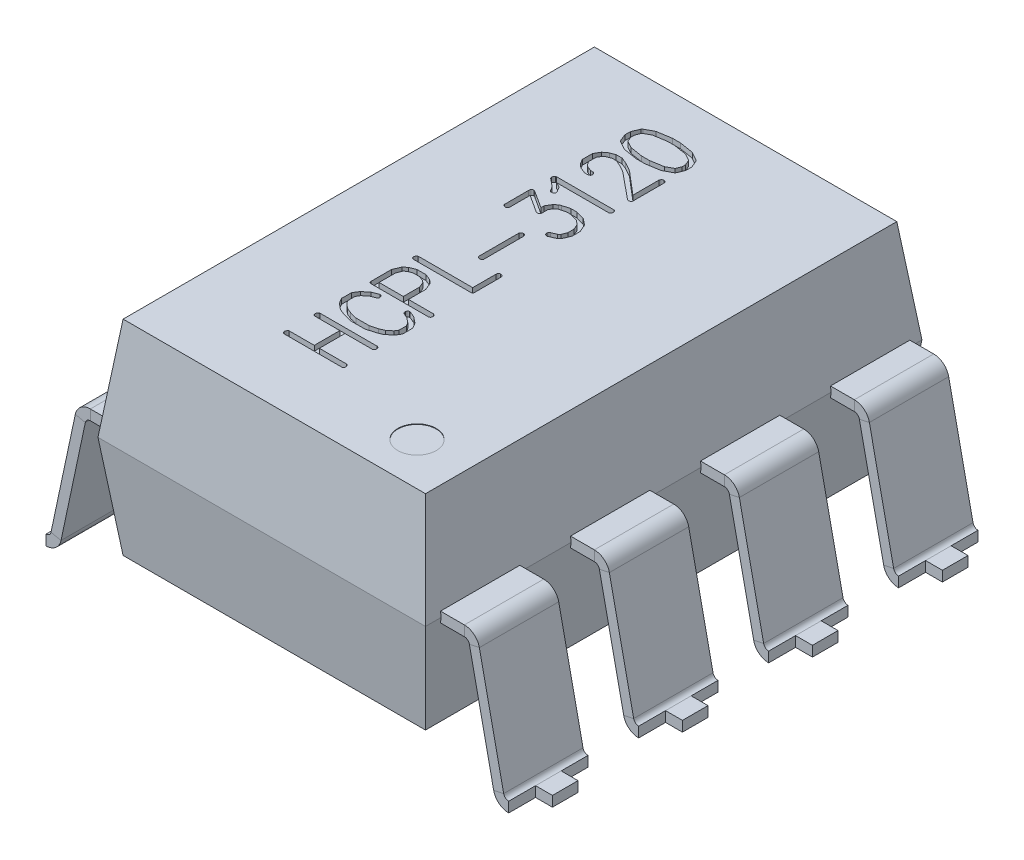
from build123d import *

# Parameters (mm, degrees)
SKETCH1_W                     = 6.4
SKETCH1_H                     = 9.7
BOSS_EXTRUDE1_DEPTH           = 2
BOSS_EXTRUDE1_TAPER           = 7
BOSS_EXTRUDE1_OTHER_WAY_DEPTH = 2
BOSS_EXTRUDE1_OTHER_WAY_TAPER = 7
SKETCH4_W                     = 1.55
SKETCH4_H                     = 0.2
SKETCH10_W                    = 0.329696675
SKETCH10_H                    = 0.525
CUT_EXTRUDE3_DEPTH            = 5
LPATTERN4_START               = -4.625
LPATTERN4_DEPTH               = 1.55
LPATTERN4_START_2             = -2.085
LPATTERN4_2_DEPTH             = 1.55
LPATTERN4_START_3             = 0.455
LPATTERN4_3_DEPTH             = 1.55
LPATTERN4_START_4             = -4.1
LPATTERN4_4_OUTLINE_W         = 0.329696675
LPATTERN4_4_OUTLINE_H         = 0.2
LPATTERN4_4_DEPTH             = 0.5
LPATTERN4_START_5             = -1.56
LPATTERN4_5_OUTLINE_W         = 0.329696675
LPATTERN4_5_OUTLINE_H         = 0.2
LPATTERN4_5_DEPTH             = 0.5
LPATTERN4_START_6             = 0.98
LPATTERN4_6_OUTLINE_W         = 0.329696675
LPATTERN4_6_OUTLINE_H         = 0.2
LPATTERN4_6_DEPTH             = 0.5
CUT_EXTRUDE2_DEPTH            = 0.1
SKETCH5_R                     = 0.375
CUT_EXTRUDE4_DEPTH            = 0.01


# Read off the part's stored shape, not the designer's step: LPattern4
with BuildPart() as part:
    # Sketch1 → Boss-Extrude1 (new body)
    with BuildSketch(Plane(origin=(0, 0, 0), x_dir=(1, 0, 0), z_dir=(0, 1, 0))):
        Rectangle(SKETCH1_W, SKETCH1_H)
    extrude(amount=BOSS_EXTRUDE1_DEPTH, taper=BOSS_EXTRUDE1_TAPER)

    # Sketch1 → Boss-Extrude1 other way (add)
    with BuildSketch(Plane(origin=(0, 0, 0), x_dir=(1, 0, 0), z_dir=(0, 1, 0))):
        Rectangle(SKETCH1_W, SKETCH1_H)
    extrude(amount=-BOSS_EXTRUDE1_OTHER_WAY_DEPTH, taper=BOSS_EXTRUDE1_OTHER_WAY_TAPER)

    # Sweep2: sweep along a path in Sketch3
    with BuildLine(Plane.XY) as sweep2_path:
        Line((2.2403605, 0), (3.65437048, 0))
        ThreePointArc((3.65437048, 0), (3.780234558, -0.044570808), (3.85, -0.158417662))
        Line((3.85, -0.158417662), (4.324673805, -2.391582338))
        ThreePointArc((4.324673805, -2.391582338), (4.394439247, -2.505429192), (4.520303325, -2.55))
        Line((4.520303325, -2.55), (4.85, -2.55))
    # Sketch4 → Sweep2 (sweep)
    with BuildSketch(Plane(origin=(3.2, 0, 0), x_dir=(0, 0, -1), z_dir=(1, 0, 0))):
        with Locations((-3.77, 0)):
            Rectangle(SKETCH4_W, SKETCH4_H)
    sweep2 = sweep(path=sweep2_path.line)

    # Sketch10 → Cut-Extrude3 (cut)
    with BuildSketch(Plane(origin=(0, -2.45, 0), x_dir=(1, 0, 0), z_dir=(0, 1, 0))):
        with Locations((4.685151663, -3.2575)):
            Rectangle(SKETCH10_W, SKETCH10_H)
        with Locations((4.685151663, -4.2825)):
            Rectangle(SKETCH10_W, SKETCH10_H)
    cut_extrude3 = extrude(amount=-CUT_EXTRUDE3_DEPTH, mode=Mode.SUBTRACT)

    # LPattern4 outline → LPattern4 (add)
    with BuildSketch(Plane.XY.offset(LPATTERN4_START)):
        with BuildLine():
            Line((3.65437048, 0.1), (3.187721544, 0.1))
            Line((3.187721544, 0.1), (3.2, 0))
            Line((3.2, 0), (3.187721544, -0.1))
            Line((3.187721544, -0.1), (3.65437048, -0.1))
            ThreePointArc((3.65437048, -0.1), (3.717302519, -0.122285404), (3.75218524, -0.179208831))
            Line((3.75218524, -0.179208831), (4.226859045, -2.412373507))
            ThreePointArc((4.226859045, -2.412373507), (4.331507208, -2.583143788), (4.520303325, -2.65))
            Line((4.520303325, -2.65), (4.520303325, -2.45))
            ThreePointArc((4.520303325, -2.45), (4.457371286, -2.427714596), (4.422488565, -2.370791169))
            Line((4.422488565, -2.370791169), (3.94781476, -0.137626493))
            ThreePointArc((3.94781476, -0.137626493), (3.843166597, 0.033143788), (3.65437048, 0.1))
        make_face()
    lpattern4 = extrude(amount=LPATTERN4_DEPTH)

    # LPattern4 2 outline → LPattern4 2 (add)
    with BuildSketch(Plane.XY.offset(LPATTERN4_START_2)):
        with BuildLine():
            Line((3.65437048, 0.1), (3.187721544, 0.1))
            Line((3.187721544, 0.1), (3.2, 0))
            Line((3.2, 0), (3.187721544, -0.1))
            Line((3.187721544, -0.1), (3.65437048, -0.1))
            ThreePointArc((3.65437048, -0.1), (3.717302519, -0.122285404), (3.75218524, -0.179208831))
            Line((3.75218524, -0.179208831), (4.226859045, -2.412373507))
            ThreePointArc((4.226859045, -2.412373507), (4.331507208, -2.583143788), (4.520303325, -2.65))
            Line((4.520303325, -2.65), (4.520303325, -2.45))
            ThreePointArc((4.520303325, -2.45), (4.457371286, -2.427714596), (4.422488565, -2.370791169))
            Line((4.422488565, -2.370791169), (3.94781476, -0.137626493))
            ThreePointArc((3.94781476, -0.137626493), (3.843166597, 0.033143788), (3.65437048, 0.1))
        make_face()
    lpattern4_2 = extrude(amount=LPATTERN4_2_DEPTH)

    # LPattern4 3 outline → LPattern4 3 (add)
    with BuildSketch(Plane.XY.offset(LPATTERN4_START_3)):
        with BuildLine():
            Line((3.65437048, 0.1), (3.187721544, 0.1))
            Line((3.187721544, 0.1), (3.2, 0))
            Line((3.2, 0), (3.187721544, -0.1))
            Line((3.187721544, -0.1), (3.65437048, -0.1))
            ThreePointArc((3.65437048, -0.1), (3.717302519, -0.122285404), (3.75218524, -0.179208831))
            Line((3.75218524, -0.179208831), (4.226859045, -2.412373507))
            ThreePointArc((4.226859045, -2.412373507), (4.331507208, -2.583143788), (4.520303325, -2.65))
            Line((4.520303325, -2.65), (4.520303325, -2.45))
            ThreePointArc((4.520303325, -2.45), (4.457371286, -2.427714596), (4.422488565, -2.370791169))
            Line((4.422488565, -2.370791169), (3.94781476, -0.137626493))
            ThreePointArc((3.94781476, -0.137626493), (3.843166597, 0.033143788), (3.65437048, 0.1))
        make_face()
    lpattern4_3 = extrude(amount=LPATTERN4_3_DEPTH)

    # LPattern4 4 outline → LPattern4 4 (add)
    with BuildSketch(Plane.XY.offset(LPATTERN4_START_4)):
        with Locations((4.685151663, -2.55)):
            Rectangle(LPATTERN4_4_OUTLINE_W, LPATTERN4_4_OUTLINE_H)
    lpattern4_4 = extrude(amount=LPATTERN4_4_DEPTH)

    # LPattern4 5 outline → LPattern4 5 (add)
    with BuildSketch(Plane.XY.offset(LPATTERN4_START_5)):
        with Locations((4.685151663, -2.55)):
            Rectangle(LPATTERN4_5_OUTLINE_W, LPATTERN4_5_OUTLINE_H)
    lpattern4_5 = extrude(amount=LPATTERN4_5_DEPTH)

    # LPattern4 6 outline → LPattern4 6 (add)
    with BuildSketch(Plane.XY.offset(LPATTERN4_START_6)):
        with Locations((4.685151663, -2.55)):
            Rectangle(LPATTERN4_6_OUTLINE_W, LPATTERN4_6_OUTLINE_H)
    lpattern4_6 = extrude(amount=LPATTERN4_6_DEPTH)

    # Mirror2: Sweep2, Cut-Extrude3, LPattern4, LPattern4 2, LPattern4 3, LPattern4 4, LPattern4 5, LPattern4 6 across plane
    add(sweep2.mirror(Plane(origin=(0, 0, 0), x_dir=(0, 0, 1), z_dir=(1, 0, 0))))
    add(cut_extrude3.mirror(Plane(origin=(0, 0, 0), x_dir=(0, 0, 1), z_dir=(1, 0, 0))), mode=Mode.SUBTRACT)
    add(lpattern4.mirror(Plane(origin=(0, 0, 0), x_dir=(0, 0, 1), z_dir=(1, 0, 0))))
    add(lpattern4_2.mirror(Plane(origin=(0, 0, 0), x_dir=(0, 0, 1), z_dir=(1, 0, 0))))
    add(lpattern4_3.mirror(Plane(origin=(0, 0, 0), x_dir=(0, 0, 1), z_dir=(1, 0, 0))))
    add(lpattern4_4.mirror(Plane(origin=(0, 0, 0), x_dir=(0, 0, 1), z_dir=(1, 0, 0))))
    add(lpattern4_5.mirror(Plane(origin=(0, 0, 0), x_dir=(0, 0, 1), z_dir=(1, 0, 0))))
    add(lpattern4_6.mirror(Plane(origin=(0, 0, 0), x_dir=(0, 0, 1), z_dir=(1, 0, 0))))

    # Sketch8 → Cut-Extrude2 (cut)
    # profile 1 of 9: a face of its own
    with BuildSketch(Plane(origin=(0, 2, 0), x_dir=(1, 0, 0), z_dir=(0, 1, 0))):
        with BuildLine():
            add(Edge.make_bspline(
                [(-1.169419643, 3.524821429), (-1.167620934, 3.528908118), (-1.163740142, 3.537725324), (-1.1578385, 3.551915849), (-1.151034501, 3.567867523), (-1.14372345, 3.585569203), (-1.135985944, 3.605153948), (-1.127082649, 3.626293824), (-1.118176155, 3.649517547), (-1.111639799, 3.665459517), (-1.108258929, 3.673705357)],
                knots=[0, 0, 0, 0, 0.665721593, 1.436322902, 2.291410995, 3.251459109, 4.291796754, 5.431062308, 6.671240151, 8, 8, 8, 8], degree=3))
            Line((-1.108258929, 3.673705357), (-1.090848214, 3.688214286))
            Line((-1.090848214, 3.688214286), (-0.931696429, 3.774151786))
            Line((-0.931696429, 3.774151786), (-0.914955357, 3.7790625))
            Line((-0.914955357, 3.7790625), (-0.65, 3.822142857))
            Line((-0.65, 3.822142857), (-0.485044643, 3.822142857))
            Line((-0.485044643, 3.822142857), (-0.213616071, 3.7775))
            Line((-0.213616071, 3.7775), (-0.208705357, 3.773928571))
            Line((-0.208705357, 3.773928571), (-0.038839286, 3.678839286))
            Line((-0.038839286, 3.678839286), (-0.031473214, 3.670133929))
            add(Edge.make_bspline(
                [(-0.031473214, 3.670133929), (-0.029657628, 3.664760515), (-0.025798258, 3.653338317), (-0.018664975, 3.635434712), (-0.010689902, 3.615396775), (-0.001941105, 3.59406877), (0.007352249, 3.573273859), (0.015109624, 3.554043583), (0.022431149, 3.537815211), (0.026653801, 3.527804899), (0.028571429, 3.523258929)],
                knots=[0, 0, 0, 0, 0.857513826, 1.822806147, 2.913397241, 4.118986067, 5.308242042, 6.357181207, 7.253948727, 8, 8, 8, 8], degree=3))
            Line((0.028571429, 3.523258929), (0.028571429, 3.411205357))
            add(Edge.make_bspline(
                [(0.028571429, 3.411205357), (0.025122374, 3.40218313), (0.017503778, 3.382253988), (0.003809982, 3.349919533), (-0.011818338, 3.311776482), (-0.02346924, 3.284625052), (-0.0296875, 3.270133929)],
                knots=[0, 0, 0, 0, 0.759314602, 1.677245352, 2.760311232, 4, 4, 4, 4], degree=3))
            Line((-0.0296875, 3.270133929), (-0.042410714, 3.257633929))
            Line((-0.042410714, 3.257633929), (-0.208035714, 3.168571429))
            Line((-0.208035714, 3.168571429), (-0.2203125, 3.165223214))
            Line((-0.2203125, 3.165223214), (-0.4875, 3.122142857))
            Line((-0.4875, 3.122142857), (-0.661160714, 3.122142857))
            Line((-0.661160714, 3.122142857), (-0.928348214, 3.165669643))
            Line((-0.928348214, 3.165669643), (-0.939955357, 3.170133929))
            Line((-0.939955357, 3.170133929), (-1.102232143, 3.260535714))
            Line((-1.102232143, 3.260535714), (-1.113839286, 3.272366071))
            add(Edge.make_bspline(
                [(-1.113839286, 3.272366071), (-1.115439052, 3.277067232), (-1.118966558, 3.287433351), (-1.125618951, 3.30405425), (-1.133104771, 3.323542939), (-1.141747209, 3.344685289), (-1.150390728, 3.365929745), (-1.158018397, 3.385528701), (-1.165099612, 3.402322627), (-1.169282161, 3.412688829), (-1.171205357, 3.417455357)],
                knots=[0, 0, 0, 0, 0.763685599, 1.683936188, 2.752919614, 3.974887314, 5.196855014, 6.280682763, 7.209433384, 8, 8, 8, 8], degree=3))
            Line((-1.171205357, 3.417455357), (-1.169419643, 3.524821429))
        make_face()
        Polygon((-1.030133929, 3.6071875), (-1.071428571, 3.502946429), (-1.071428571, 3.4321875), (-1.032142857, 3.335758929), (-0.898660714, 3.262098214), (-0.652901786, 3.222142857), (-0.495982143, 3.222142857), (-0.2453125, 3.2634375), (-0.110491071, 3.337098214), (-0.071428571, 3.431964286), (-0.071428571, 3.502276786), (-0.115848214, 3.608526786), (-0.249553571, 3.682410714), (-0.495982143, 3.722142857), (-0.640848214, 3.722142857), (-0.894642857, 3.681071429), align=None, mode=Mode.SUBTRACT)
    # profile 2 of 9: a face of its own
    with BuildSketch(Plane(origin=(0, 2, 0), x_dir=(1, 0, 0), z_dir=(0, 1, 0))):
        with BuildLine():
            add(Edge.make_bspline(
                [(-1.169419643, 2.784955357), (-1.165548864, 2.791427501), (-1.156883756, 2.805916013), (-1.14253021, 2.830014929), (-1.125856478, 2.85911626), (-1.113838156, 2.880118489), (-1.107366071, 2.891428571)],
                knots=[0, 0, 0, 0, 0.73430934, 1.64382151, 2.731155109, 4, 4, 4, 4], degree=3))
            add(Edge.make_bspline(
                [(-1.107366071, 2.891428571), (-1.098826472, 2.89889665), (-1.082366086, 2.913291641), (-1.058469751, 2.93351085), (-1.035099527, 2.950172327), (-1.018029073, 2.955773158), (-1.010044643, 2.958392857)],
                knots=[0, 0, 0, 0, 1.141605867, 2.200486343, 3.158306401, 4, 4, 4, 4], degree=3))
            add(Edge.make_bspline(
                [(-1.010044643, 2.958392857), (-1.005287453, 2.960486963), (-0.994029395, 2.965442736), (-0.974350928, 2.97373049), (-0.949173255, 2.9835958), (-0.930650638, 2.990971979), (-0.920535714, 2.995)],
                knots=[0, 0, 0, 0, 0.644916142, 1.526216651, 2.649103883, 4, 4, 4, 4], degree=3))
            Line((-0.920535714, 2.995), (-0.800892857, 2.995))
            add(Edge.make_bspline(
                [(-0.800892857, 2.995), (-0.79851033, 2.99403657), (-0.793066186, 2.991835104), (-0.783859458, 2.987993236), (-0.77258081, 2.983303864), (-0.759079037, 2.978064319), (-0.743738655, 2.971409711), (-0.726139023, 2.964361822), (-0.706409224, 2.956616563), (-0.692697752, 2.950904184), (-0.685491071, 2.947901786)],
                knots=[0, 0, 0, 0, 0.494830354, 1.130701655, 1.920862883, 2.846661133, 3.918939794, 5.140047354, 6.496823261, 8, 8, 8, 8], degree=3))
            Line((-0.685491071, 2.947901786), (-0.517857143, 2.853258929))
            Line((-0.517857143, 2.853258929), (-0.071428571, 2.473125))
            Line((-0.071428571, 2.473125), (-0.071428571, 2.985848214))
            add(Edge.make_bspline(
                [(-0.071428571, 2.985848214), (-0.068617114, 2.992275149), (-0.063386557, 3.004232096), (-0.051442219, 3.018475419), (-0.036574525, 3.027223659), (-0.025778007, 3.028207373), (-0.0203125, 3.028705357)],
                knots=[0, 0, 0, 0, 1.177935771, 2.191482808, 3.084476649, 4, 4, 4, 4], degree=3))
            add(Edge.make_bspline(
                [(-0.0203125, 3.028705357), (-0.015978739, 3.027651143), (-0.005697244, 3.025150105), (0.004275511, 3.021604605), (0.010044643, 3.019553571)],
                knots=[0, 0, 0, 0, 0.843021521, 2, 2, 2, 2], degree=3))
            add(Edge.make_bspline(
                [(0.010044643, 3.019553571), (0.012887346, 3.017325026), (0.018645344, 3.012811027), (0.024504178, 3.002795174), (0.028114495, 2.990711649), (0.028412551, 2.981860772), (0.028571429, 2.977142857)],
                knots=[0, 0, 0, 0, 0.891461185, 1.805686744, 2.830332357, 4, 4, 4, 4], degree=3))
            Line((0.028571429, 2.977142857), (0.028571429, 2.367544643))
            add(Edge.make_bspline(
                [(0.028571429, 2.367544643), (0.026980764, 2.363511506), (0.023869548, 2.355623003), (0.014297683, 2.346357335), (0.001523706, 2.340337046), (-0.008191285, 2.338721913), (-0.013392857, 2.337857143)],
                knots=[0, 0, 0, 0, 0.943026244, 1.844486298, 2.845901122, 4, 4, 4, 4], degree=3))
            add(Edge.make_bspline(
                [(-0.013392857, 2.337857143), (-0.017436291, 2.337986992), (-0.025337551, 2.338240729), (-0.036618595, 2.341466606), (-0.047359738, 2.345653674), (-0.053436166, 2.350278006), (-0.056473214, 2.352589286)],
                knots=[0, 0, 0, 0, 1.041667809, 2.035519422, 3.018136481, 4, 4, 4, 4], degree=3))
            Line((-0.056473214, 2.352589286), (-0.574107143, 2.776473214))
            Line((-0.574107143, 2.776473214), (-0.728571429, 2.859508929))
            Line((-0.728571429, 2.859508929), (-0.815178571, 2.895))
            Line((-0.815178571, 2.895), (-0.898660714, 2.895))
            Line((-0.898660714, 2.895), (-0.988392857, 2.857723214))
            Line((-0.988392857, 2.857723214), (-1.028571429, 2.826026786))
            Line((-1.028571429, 2.826026786), (-1.071428571, 2.753258929))
            Line((-1.071428571, 2.753258929), (-1.071428571, 2.609285714))
            Line((-1.071428571, 2.609285714), (-1.032142857, 2.545446429))
            Line((-1.032142857, 2.545446429), (-0.993303571, 2.514196429))
            Line((-0.993303571, 2.514196429), (-0.902455357, 2.477142857))
            Line((-0.902455357, 2.477142857), (-0.864732143, 2.477142857))
            add(Edge.make_bspline(
                [(-0.864732143, 2.477142857), (-0.859911069, 2.47683126), (-0.850369049, 2.476214537), (-0.836943829, 2.470220094), (-0.825228377, 2.460448747), (-0.819229007, 2.451935851), (-0.816071429, 2.447455357)],
                knots=[0, 0, 0, 0, 0.965776422, 1.911495068, 2.90078151, 4, 4, 4, 4], degree=3))
            add(Edge.make_bspline(
                [(-0.816071429, 2.447455357), (-0.814805392, 2.442869685), (-0.812579269, 2.434806513), (-0.811744115, 2.426488985), (-0.811383929, 2.422901786)],
                knots=[0, 0, 0, 0, 1.137436311, 2, 2, 2, 2], degree=3))
            add(Edge.make_bspline(
                [(-0.811383929, 2.422901786), (-0.811502672, 2.419988197), (-0.811728185, 2.414454812), (-0.813672763, 2.406702443), (-0.817277859, 2.400162485), (-0.820810164, 2.396999539), (-0.822544643, 2.395446429)],
                knots=[0, 0, 0, 0, 1.136674048, 2.158730958, 3.095876187, 4, 4, 4, 4], degree=3))
            add(Edge.make_bspline(
                [(-0.822544643, 2.395446429), (-0.825103068, 2.392901983), (-0.830393248, 2.38764071), (-0.841183749, 2.382642636), (-0.853828901, 2.379457963), (-0.862996987, 2.379257862), (-0.867857143, 2.379151786)],
                knots=[0, 0, 0, 0, 0.866136715, 1.790952628, 2.828946889, 4, 4, 4, 4], degree=3))
            add(Edge.make_bspline(
                [(-0.867857143, 2.379151786), (-0.869043367, 2.378892335), (-0.871907165, 2.378265967), (-0.877162903, 2.3782789), (-0.884088512, 2.378120378), (-0.889287267, 2.378639159), (-0.8921875, 2.378928571)],
                knots=[0, 0, 0, 0, 0.595117925, 1.436741766, 2.570033676, 4, 4, 4, 4], degree=3))
            add(Edge.make_bspline(
                [(-0.8921875, 2.378928571), (-0.897243742, 2.379375048), (-0.907343158, 2.380266847), (-0.917481854, 2.380267521), (-0.922544643, 2.380267857)],
                knots=[0, 0, 0, 0, 1.001293942, 2, 2, 2, 2], degree=3))
            add(Edge.make_bspline(
                [(-0.922544643, 2.380267857), (-0.930286231, 2.383309656), (-0.947351044, 2.390014707), (-0.975083542, 2.40115287), (-1.007332059, 2.414096845), (-1.030214912, 2.423480804), (-1.042410714, 2.428482143)],
                knots=[0, 0, 0, 0, 0.772538479, 1.702909645, 2.775726916, 4, 4, 4, 4], degree=3))
            add(Edge.make_bspline(
                [(-1.042410714, 2.428482143), (-1.050329546, 2.434542906), (-1.06568634, 2.446296395), (-1.080682929, 2.458506), (-1.087946429, 2.464419643)],
                knots=[0, 0, 0, 0, 1.031313027, 2, 2, 2, 2], degree=3))
            add(Edge.make_bspline(
                [(-1.087946429, 2.464419643), (-1.09265461, 2.468337924), (-1.101373298, 2.475593861), (-1.112204931, 2.487180963), (-1.120665153, 2.497992747), (-1.124086948, 2.505714256), (-1.125669643, 2.509285714)],
                knots=[0, 0, 0, 0, 1.239250072, 2.294863997, 3.211317278, 4, 4, 4, 4], degree=3))
            Line((-1.125669643, 2.509285714), (-1.168526786, 2.5809375))
            Line((-1.168526786, 2.5809375), (-1.171205357, 2.5903125))
            Line((-1.171205357, 2.5903125), (-1.169419643, 2.784955357))
        make_face()
    # profile 3 of 9: a face of its own
    with BuildSketch(Plane(origin=(0, 2, 0), x_dir=(1, 0, 0), z_dir=(0, 1, 0))):
        with BuildLine():
            Line((-1.143973214, 2.035044643), (-1.130133929, 2.039285714))
            Line((-1.130133929, 2.039285714), (-0.008482143, 2.0390625))
            add(Edge.make_bspline(
                [(-0.008482143, 2.0390625), (-0.003681635, 2.037968058), (0.005818789, 2.035802109), (0.017296201, 2.025122041), (0.025077464, 2.009937575), (0.027338519, 1.998017593), (0.028571429, 1.991517857)],
                knots=[0, 0, 0, 0, 0.894623444, 1.770500318, 2.784296937, 4, 4, 4, 4], degree=3))
            add(Edge.make_bspline(
                [(0.028571429, 1.991517857), (0.028339959, 1.985452059), (0.027919425, 1.974431685), (0.023334079, 1.959592348), (0.014996185, 1.948350124), (0.007197659, 1.944523028), (0.003348214, 1.942633929)],
                knots=[0, 0, 0, 0, 1.236245911, 2.246018165, 3.134213831, 4, 4, 4, 4], degree=3))
            Line((0.003348214, 1.942633929), (-0.006919643, 1.939285714))
            Line((-0.006919643, 1.939285714), (-1.028571429, 1.939285714))
            Line((-1.028571429, 1.939285714), (-0.9296875, 1.890848214))
            Line((-0.9296875, 1.890848214), (-0.867633929, 1.787723214))
            add(Edge.make_bspline(
                [(-0.867633929, 1.787723214), (-0.866809737, 1.784388679), (-0.86508517, 1.777411384), (-0.864413284, 1.77025442), (-0.8640625, 1.766517857)],
                knots=[0, 0, 0, 0, 0.955824711, 2, 2, 2, 2], degree=3))
            add(Edge.make_bspline(
                [(-0.8640625, 1.766517857), (-0.864225358, 1.763812655), (-0.864550327, 1.75841465), (-0.867481208, 1.750719105), (-0.871698038, 1.743326474), (-0.878024585, 1.737095479), (-0.885309444, 1.731624753), (-0.893859656, 1.727842131), (-0.903267658, 1.725228809), (-0.909951064, 1.725077777), (-0.913392857, 1.725)],
                knots=[0, 0, 0, 0, 0.90316433, 1.802188847, 2.73013921, 3.735279176, 4.752714891, 5.768009598, 6.850578473, 8, 8, 8, 8], degree=3))
            add(Edge.make_bspline(
                [(-0.913392857, 1.725), (-0.916079511, 1.72516086), (-0.921333867, 1.725475458), (-0.926495478, 1.726505545), (-0.929017857, 1.727008929)],
                knots=[0, 0, 0, 0, 1.022638749, 2, 2, 2, 2], degree=3))
            add(Edge.make_bspline(
                [(-0.929017857, 1.727008929), (-0.934388689, 1.72944274), (-0.944249059, 1.733911002), (-0.950961573, 1.742358923), (-0.954017857, 1.746205357)],
                knots=[0, 0, 0, 0, 1.08937731, 2, 2, 2, 2], degree=3))
            Line((-0.954017857, 1.746205357), (-1.002232143, 1.826116071))
            Line((-1.002232143, 1.826116071), (-1.159598214, 1.955133929))
            add(Edge.make_bspline(
                [(-1.159598214, 1.955133929), (-1.161395146, 1.956846852), (-1.164962798, 1.960247713), (-1.168815886, 1.966674235), (-1.171140178, 1.974024049), (-1.171330079, 1.979223119), (-1.171428571, 1.981919643)],
                knots=[0, 0, 0, 0, 0.98022139, 1.946145258, 2.934757973, 4, 4, 4, 4], degree=3))
            add(Edge.make_bspline(
                [(-1.171428571, 1.981919643), (-1.171076425, 1.986877788), (-1.170374009, 1.996767647), (-1.164908255, 2.010907875), (-1.156189312, 2.024076922), (-1.148177841, 2.031269691), (-1.143973214, 2.035044643)],
                knots=[0, 0, 0, 0, 0.960804293, 1.916486586, 2.906518233, 4, 4, 4, 4], degree=3))
        make_face()
    # profile 4 of 9: a face of its own
    with BuildSketch(Plane(origin=(0, 2, 0), x_dir=(1, 0, 0), z_dir=(0, 1, 0))):
        with BuildLine():
            add(Edge.make_bspline(
                [(-1.124330357, 1.590714286), (-1.12192825, 1.590517521), (-1.116534617, 1.59007571), (-1.108107944, 1.586808382), (-1.098471216, 1.582125354), (-1.09192502, 1.57799017), (-1.088392857, 1.575758929)],
                knots=[0, 0, 0, 0, 0.731496768, 1.642485333, 2.72794448, 4, 4, 4, 4], degree=3))
            add(Edge.make_bspline(
                [(-1.088392857, 1.575758929), (-1.084617725, 1.573329928), (-1.078318401, 1.56927681), (-1.074367479, 1.567171951), (-1.067209352, 1.562411208), (-1.068221924, 1.563402233), (-1.068303571, 1.563482143)],
                knots=[0, 0, 0, 0, 2.008870959, 3.352075358, 3.947755404, 4, 4, 4, 4], degree=3))
            Line((-1.068303571, 1.563482143), (-0.757142857, 1.362366071))
            Line((-0.757142857, 1.362366071), (-0.757142857, 1.426428571))
            add(Edge.make_bspline(
                [(-0.757142857, 1.426428571), (-0.753136185, 1.433206093), (-0.744220244, 1.448287931), (-0.72918482, 1.473091443), (-0.711317794, 1.502504684), (-0.698575179, 1.523743269), (-0.691741071, 1.535133929)],
                knots=[0, 0, 0, 0, 0.744723836, 1.65721417, 2.743519113, 4, 4, 4, 4], degree=3))
            Line((-0.691741071, 1.535133929), (-0.633035714, 1.583348214))
            add(Edge.make_bspline(
                [(-0.633035714, 1.583348214), (-0.631209825, 1.584671065), (-0.626898915, 1.587794305), (-0.618547307, 1.591477827), (-0.608053894, 1.595850463), (-0.600102485, 1.598303083), (-0.595758929, 1.599642857)],
                knots=[0, 0, 0, 0, 0.660434001, 1.559278996, 2.666725834, 4, 4, 4, 4], degree=3))
            add(Edge.make_bspline(
                [(-0.595758929, 1.599642857), (-0.586679804, 1.602166395), (-0.566503041, 1.607774515), (-0.533183815, 1.617199931), (-0.493672372, 1.628351671), (-0.465252381, 1.636396698), (-0.45, 1.640714286)],
                knots=[0, 0, 0, 0, 0.746719963, 1.659454107, 2.743880703, 4, 4, 4, 4], degree=3))
            Line((-0.45, 1.640714286), (-0.33125, 1.640714286))
            add(Edge.make_bspline(
                [(-0.33125, 1.640714286), (-0.31511534, 1.636135089), (-0.284290423, 1.627386635), (-0.240006418, 1.615502696), (-0.20007499, 1.604347635), (-0.1747127, 1.597818604), (-0.162723214, 1.594732143)],
                knots=[0, 0, 0, 0, 1.152088605, 2.201040242, 3.149579839, 4, 4, 4, 4], degree=3))
            add(Edge.make_bspline(
                [(-0.162723214, 1.594732143), (-0.160783034, 1.593326116), (-0.155878365, 1.589771758), (-0.147226753, 1.583095244), (-0.135895262, 1.573765098), (-0.121230532, 1.562613267), (-0.104296422, 1.548272804), (-0.083728233, 1.532481485), (-0.060935869, 1.513540912), (-0.044586889, 1.500364046), (-0.0359375, 1.493392857)],
                knots=[0, 0, 0, 0, 0.354260306, 0.895550937, 1.615424868, 2.52432519, 3.618802696, 4.895348182, 6.357491474, 8, 8, 8, 8], degree=3))
            add(Edge.make_bspline(
                [(-0.0359375, 1.493392857), (-0.033396803, 1.487966641), (-0.027989056, 1.476417208), (-0.019618981, 1.457920607), (-0.011334749, 1.436863639), (-0.002467997, 1.4145487), (0.005963453, 1.392533066), (0.014206865, 1.372981437), (0.021589789, 1.35653794), (0.026391133, 1.346730401), (0.028571429, 1.342276786)],
                knots=[0, 0, 0, 0, 0.874891023, 1.862162089, 2.963690054, 4.178202179, 5.368517335, 6.405638877, 7.275998682, 8, 8, 8, 8], degree=3))
            Line((0.028571429, 1.342276786), (0.028571429, 1.186026786))
            add(Edge.make_bspline(
                [(0.028571429, 1.186026786), (0.025195013, 1.177302667), (0.017713592, 1.157971872), (0.004246055, 1.126531301), (-0.011158119, 1.089279568), (-0.022651992, 1.062720633), (-0.028794643, 1.048526786)],
                knots=[0, 0, 0, 0, 0.753366235, 1.669299668, 2.754407724, 4, 4, 4, 4], degree=3))
            add(Edge.make_bspline(
                [(-0.028794643, 1.048526786), (-0.029669352, 1.04754115), (-0.031874397, 1.045056473), (-0.036491722, 1.041193252), (-0.042477426, 1.035711842), (-0.050314911, 1.0291261), (-0.059670319, 1.021069175), (-0.070637149, 1.011640613), (-0.083284935, 1.000998483), (-0.092329706, 0.993533722), (-0.097098214, 0.989598214)],
                knots=[0, 0, 0, 0, 0.350081131, 0.882515176, 1.597343563, 2.509514018, 3.604118565, 4.881157203, 6.35571015, 8, 8, 8, 8], degree=3))
            Line((-0.097098214, 0.989598214), (-0.213169643, 0.940714286))
            Line((-0.213169643, 0.940714286), (-0.225669643, 0.940714286))
            add(Edge.make_bspline(
                [(-0.225669643, 0.940714286), (-0.231717957, 0.941097941), (-0.243185042, 0.941825317), (-0.252815295, 0.948043663), (-0.257366071, 0.950982143)],
                knots=[0, 0, 0, 0, 1.054899985, 2, 2, 2, 2], degree=3))
            add(Edge.make_bspline(
                [(-0.257366071, 0.950982143), (-0.259843639, 0.953927161), (-0.264802523, 0.959821652), (-0.26925318, 0.970801905), (-0.272689827, 0.982689935), (-0.272888152, 0.99120576), (-0.272991071, 0.995625)],
                knots=[0, 0, 0, 0, 0.948207327, 1.89784916, 2.909100566, 4, 4, 4, 4], degree=3))
            add(Edge.make_bspline(
                [(-0.272991071, 0.995625), (-0.271081945, 1.00035794), (-0.267562854, 1.009082165), (-0.261350015, 1.020396094), (-0.254042129, 1.02865026), (-0.248241397, 1.031701695), (-0.245535714, 1.033125)],
                knots=[0, 0, 0, 0, 1.28205388, 2.363209, 3.236538274, 4, 4, 4, 4], degree=3))
            Line((-0.245535714, 1.033125), (-0.146428571, 1.074419643))
            Line((-0.146428571, 1.074419643), (-0.111383929, 1.105446429))
            Line((-0.111383929, 1.105446429), (-0.071428571, 1.205446429))
            Line((-0.071428571, 1.205446429), (-0.071428571, 1.320625))
            Line((-0.071428571, 1.320625), (-0.116741071, 1.43))
            Line((-0.116741071, 1.43), (-0.2046875, 1.501875))
            Line((-0.2046875, 1.501875), (-0.346205357, 1.540714286))
            Line((-0.346205357, 1.540714286), (-0.436383929, 1.540714286))
            Line((-0.436383929, 1.540714286), (-0.575669643, 1.502767857))
            Line((-0.575669643, 1.502767857), (-0.614508929, 1.469508929))
            Line((-0.614508929, 1.469508929), (-0.657142857, 1.398080357))
            Line((-0.657142857, 1.398080357), (-0.657142857, 1.270848214))
            add(Edge.make_bspline(
                [(-0.657142857, 1.270848214), (-0.658618074, 1.266294269), (-0.661487755, 1.257435658), (-0.671070322, 1.246951486), (-0.683869873, 1.239918535), (-0.693656433, 1.238254771), (-0.698883929, 1.237366071)],
                knots=[0, 0, 0, 0, 0.993260278, 1.932149966, 2.895457034, 4, 4, 4, 4], degree=3))
            add(Edge.make_bspline(
                [(-0.698883929, 1.237366071), (-0.705099862, 1.237490145), (-0.716191256, 1.237711534), (-0.726186661, 1.242433352), (-0.730580357, 1.244508929)],
                knots=[0, 0, 0, 0, 1.120856984, 2, 2, 2, 2], degree=3))
            Line((-0.730580357, 1.244508929), (-1.071428571, 1.465714286))
            Line((-1.071428571, 1.465714286), (-1.071428571, 1.060133929))
            add(Edge.make_bspline(
                [(-1.071428571, 1.060133929), (-1.072670382, 1.055932714), (-1.075108953, 1.047682699), (-1.083153116, 1.037049534), (-1.094978068, 1.029518539), (-1.104218393, 1.026922001), (-1.109151786, 1.025535714)],
                knots=[0, 0, 0, 0, 0.961552233, 1.888220791, 2.872524955, 4, 4, 4, 4], degree=3))
            add(Edge.make_bspline(
                [(-1.109151786, 1.025535714), (-1.115283182, 1.02575551), (-1.126641662, 1.026162685), (-1.142230382, 1.030029626), (-1.155348957, 1.036065656), (-1.161684189, 1.042519824), (-1.164732143, 1.045625)],
                knots=[0, 0, 0, 0, 1.204793626, 2.231893546, 3.149343424, 4, 4, 4, 4], degree=3))
            Line((-1.164732143, 1.045625), (-1.169642857, 1.059017857))
            Line((-1.169642857, 1.059017857), (-1.171428571, 1.529776786))
            add(Edge.make_bspline(
                [(-1.171428571, 1.529776786), (-1.171336962, 1.534548165), (-1.171165423, 1.543482601), (-1.168961382, 1.555997921), (-1.165168563, 1.566644221), (-1.1600682, 1.57553408), (-1.153387793, 1.582683105), (-1.144818336, 1.587275135), (-1.135029225, 1.590342496), (-1.128002226, 1.590586687), (-1.124330357, 1.590714286)],
                knots=[0, 0, 0, 0, 1.302296161, 2.438557397, 3.454453739, 4.374755197, 5.222865942, 6.087619718, 7.000710084, 8, 8, 8, 8], degree=3))
        make_face()
    # profile 5 of 9: a face of its own
    with BuildSketch(Plane(origin=(0, 2, 0), x_dir=(1, 0, 0), z_dir=(0, 1, 0))):
        with BuildLine():
            add(Edge.make_bspline(
                [(-0.542857143, 0.718035714), (-0.540819996, 0.722057304), (-0.537069799, 0.729460675), (-0.530289944, 0.738465054), (-0.524098041, 0.745595106), (-0.519206873, 0.748278568), (-0.516964286, 0.749508929)],
                knots=[0, 0, 0, 0, 1.301616452, 2.396153835, 3.26464075, 4, 4, 4, 4], degree=3))
            add(Edge.make_bspline(
                [(-0.516964286, 0.749508929), (-0.51347905, 0.751499128), (-0.506548794, 0.755456562), (-0.49859612, 0.756105824), (-0.494642857, 0.756428571)],
                knots=[0, 0, 0, 0, 1.005802731, 2, 2, 2, 2], degree=3))
            add(Edge.make_bspline(
                [(-0.494642857, 0.756428571), (-0.490149183, 0.756080544), (-0.480715431, 0.755349915), (-0.469076871, 0.751469947), (-0.459622481, 0.746089977), (-0.453476048, 0.738675122), (-0.447638745, 0.729207355), (-0.444535478, 0.721812076), (-0.442857143, 0.7178125)],
                knots=[0, 0, 0, 0, 1.159722921, 2.434653694, 3.132698076, 3.934680822, 4.883016789, 6, 6, 6, 6], degree=3))
            Line((-0.442857143, 0.7178125), (-0.442857143, -0.068794643))
            add(Edge.make_bspline(
                [(-0.442857143, -0.068794643), (-0.444087591, -0.073202304), (-0.446451823, -0.081671361), (-0.455666716, -0.09177384), (-0.468357484, -0.098398844), (-0.478186759, -0.099903613), (-0.483482143, -0.100714286)],
                knots=[0, 0, 0, 0, 0.973475482, 1.870474633, 2.852748143, 4, 4, 4, 4], degree=3))
            add(Edge.make_bspline(
                [(-0.483482143, -0.100714286), (-0.489175411, -0.100526609), (-0.49985431, -0.100174584), (-0.514537591, -0.095767645), (-0.527078564, -0.088877155), (-0.53299376, -0.08187669), (-0.5359375, -0.078392857)],
                knots=[0, 0, 0, 0, 1.149762186, 2.15661627, 3.082626732, 4, 4, 4, 4], degree=3))
            add(Edge.make_bspline(
                [(-0.5359375, -0.078392857), (-0.536846608, -0.077063652), (-0.539355926, -0.073394785), (-0.541493804, -0.069495518), (-0.542857143, -0.067008929)],
                knots=[0, 0, 0, 0, 0.724586177, 2, 2, 2, 2], degree=3))
            Line((-0.542857143, -0.067008929), (-0.542857143, 0.718035714))
        make_face()
    # profile 6 of 9: a face of its own
    with BuildSketch(Plane(origin=(0, 2, 0), x_dir=(1, 0, 0), z_dir=(0, 1, 0))):
        with BuildLine():
            Line((-1.138392857, -0.657991071), (-1.127008929, -0.656428571))
            Line((-1.127008929, -0.656428571), (-0.071428571, -0.656428571))
            Line((-0.071428571, -0.656428571), (-0.071205357, -0.197723214))
            add(Edge.make_bspline(
                [(-0.071205357, -0.197723214), (-0.069688456, -0.191277033), (-0.066926559, -0.179540147), (-0.058186155, -0.164642265), (-0.045667001, -0.154574469), (-0.035650405, -0.152545068), (-0.030580357, -0.151517857)],
                knots=[0, 0, 0, 0, 1.193241942, 2.172595273, 3.075032188, 4, 4, 4, 4], degree=3))
            add(Edge.make_bspline(
                [(-0.030580357, -0.151517857), (-0.024880288, -0.151755232), (-0.014055187, -0.152206033), (0.001105144, -0.157366344), (0.014114276, -0.165946662), (0.020301929, -0.174147716), (0.0234375, -0.178303571)],
                knots=[0, 0, 0, 0, 1.082014973, 2.054873413, 3.014313908, 4, 4, 4, 4], degree=3))
            Line((0.0234375, -0.178303571), (0.028571429, -0.192589286))
            Line((0.028571429, -0.192589286), (0.028571429, -0.726741071))
            add(Edge.make_bspline(
                [(0.028571429, -0.726741071), (0.027037909, -0.730754814), (0.024083219, -0.738488241), (0.015397796, -0.747714076), (0.003967549, -0.753914251), (-0.004759195, -0.755558752), (-0.009375, -0.756428571)],
                knots=[0, 0, 0, 0, 0.999890169, 1.926525383, 2.903284662, 4, 4, 4, 4], degree=3))
            Line((-0.009375, -0.756428571), (-1.137053571, -0.756428571))
            add(Edge.make_bspline(
                [(-1.137053571, -0.756428571), (-1.141571488, -0.754896821), (-1.150133089, -0.751994103), (-1.160649605, -0.74373755), (-1.168290078, -0.733060313), (-1.17036013, -0.724622809), (-1.171428571, -0.720267857)],
                knots=[0, 0, 0, 0, 1.077224726, 2.041376689, 2.989071786, 4, 4, 4, 4], degree=3))
            add(Edge.make_bspline(
                [(-1.171428571, -0.720267857), (-1.171114996, -0.713509227), (-1.170517369, -0.700628309), (-1.164013544, -0.682903011), (-1.153478777, -0.667922898), (-1.143492369, -0.661348339), (-1.138392857, -0.657991071)],
                knots=[0, 0, 0, 0, 1.090440424, 2.07821324, 3.01864879, 4, 4, 4, 4], degree=3))
        make_face()
    # profile 7 of 9: a face of its own
    with BuildSketch(Plane(origin=(0, 2, 0), x_dir=(1, 0, 0), z_dir=(0, 1, 0))):
        with BuildLine():
            add(Edge.make_bspline(
                [(-1.171428571, -1.1440625), (-1.169639325, -1.139971801), (-1.165806389, -1.131208675), (-1.159791548, -1.11724624), (-1.153370634, -1.101568006), (-1.146219659, -1.084383983), (-1.138366446, -1.065681396), (-1.130118296, -1.045259218), (-1.12122421, -1.02322156), (-1.115032695, -1.007975012), (-1.111830357, -1.000089286)],
                knots=[0, 0, 0, 0, 0.687672232, 1.473136502, 2.341424306, 3.296980082, 4.339804808, 5.465533109, 6.689138552, 8, 8, 8, 8], degree=3))
            add(Edge.make_bspline(
                [(-1.111830357, -1.000089286), (-1.108568694, -0.99709958), (-1.100446309, -0.989654438), (-1.085449788, -0.976732088), (-1.065142046, -0.960161745), (-1.049927215, -0.947780637), (-1.041517857, -0.9409375)],
                knots=[0, 0, 0, 0, 0.577714825, 1.438659379, 2.584326625, 4, 4, 4, 4], degree=3))
            Line((-1.041517857, -0.9409375), (-0.924776786, -0.894285714))
            add(Edge.make_bspline(
                [(-0.924776786, -0.894285714), (-0.91964327, -0.894117731), (-0.90870861, -0.893759917), (-0.891368994, -0.893606447), (-0.872170431, -0.893466816), (-0.851119487, -0.892774333), (-0.828198273, -0.893051328), (-0.803422888, -0.892694486), (-0.776786221, -0.892445554), (-0.758407804, -0.892481416), (-0.748883929, -0.8925)],
                knots=[0, 0, 0, 0, 0.700738521, 1.492610236, 2.365686837, 3.320131321, 4.365722147, 5.492569638, 6.700624992, 8, 8, 8, 8], degree=3))
            add(Edge.make_bspline(
                [(-0.748883929, -0.8925), (-0.740776206, -0.89585402), (-0.723386443, -0.903047854), (-0.695423344, -0.914465134), (-0.663778495, -0.927132343), (-0.641444785, -0.936030152), (-0.6296875, -0.940714286)],
                knots=[0, 0, 0, 0, 0.818861286, 1.756325956, 2.818847536, 4, 4, 4, 4], degree=3))
            Line((-0.6296875, -0.940714286), (-0.561160714, -0.995848214))
            add(Edge.make_bspline(
                [(-0.561160714, -0.995848214), (-0.557164506, -1.006050304), (-0.548542184, -1.028062592), (-0.534213542, -1.063209878), (-0.517882746, -1.103106696), (-0.506191084, -1.131196853), (-0.5, -1.146071429)],
                knots=[0, 0, 0, 0, 0.810609562, 1.748991876, 2.808024046, 4, 4, 4, 4], degree=3))
            Line((-0.5, -1.146071429), (-0.5, -1.483571429))
            Line((-0.5, -1.483571429), (-0.013616071, -1.483571429))
            add(Edge.make_bspline(
                [(-0.013616071, -1.483571429), (-0.009808148, -1.484801986), (-0.001853346, -1.487372637), (0.008959729, -1.495264955), (0.019399523, -1.506002147), (0.025362721, -1.514783704), (0.028571429, -1.519508929)],
                knots=[0, 0, 0, 0, 0.841964727, 1.758875127, 2.794084094, 4, 4, 4, 4], degree=3))
            Line((0.028571429, -1.519508929), (0.028571429, -1.540714286))
            add(Edge.make_bspline(
                [(0.028571429, -1.540714286), (0.028494488, -1.543860342), (0.028345262, -1.549962158), (0.025727155, -1.5584919), (0.021961346, -1.566114343), (0.016512883, -1.572379485), (0.009986877, -1.577280947), (0.002667231, -1.580946618), (-0.005512873, -1.583287562), (-0.011293063, -1.583474594), (-0.014285714, -1.583571429)],
                knots=[0, 0, 0, 0, 1.103289427, 2.139844208, 3.112501165, 4.078784618, 5.032553233, 5.969985878, 6.948974845, 8, 8, 8, 8], degree=3))
            Line((-0.014285714, -1.583571429), (-1.136830357, -1.583571429))
            add(Edge.make_bspline(
                [(-1.136830357, -1.583571429), (-1.141342683, -1.582114028), (-1.14997377, -1.579326342), (-1.160632061, -1.571172744), (-1.168336103, -1.560364003), (-1.170370492, -1.551842646), (-1.171428571, -1.547410714)],
                knots=[0, 0, 0, 0, 1.064767976, 2.036666745, 2.978876548, 4, 4, 4, 4], degree=3))
            Line((-1.171428571, -1.547410714), (-1.171428571, -1.1440625))
        make_face()
        Polygon((-1.030133929, -1.0565625), (-1.0734375, -1.164375), (-1.075, -1.483571429), (-0.6, -1.483571429), (-0.6, -1.166607143), (-0.644419643, -1.056785714), (-0.682589286, -1.026651786), (-0.770758929, -0.989151786), (-0.902455357, -0.989151786), (-0.991071429, -1.025982143), align=None, mode=Mode.SUBTRACT)
    # profile 8 of 9: a face of its own
    with BuildSketch(Plane(origin=(0, 2, 0), x_dir=(1, 0, 0), z_dir=(0, 1, 0))):
        with BuildLine():
            Line((-1.104241071, -1.820089286), (-0.985714286, -1.725892857))
            Line((-0.985714286, -1.725892857), (-0.864955357, -1.677232143))
            add(Edge.make_bspline(
                [(-0.864955357, -1.677232143), (-0.860834971, -1.677505701), (-0.852640222, -1.678049761), (-0.840833734, -1.681947805), (-0.829983356, -1.688620081), (-0.824054724, -1.694792266), (-0.820982143, -1.697991071)],
                knots=[0, 0, 0, 0, 0.985000521, 1.958998721, 2.942227802, 4, 4, 4, 4], degree=3))
            add(Edge.make_bspline(
                [(-0.820982143, -1.697991071), (-0.819603479, -1.702072352), (-0.817131798, -1.709389307), (-0.814330651, -1.71932846), (-0.81204108, -1.726694482), (-0.811567284, -1.730944541), (-0.811383929, -1.732589286)],
                knots=[0, 0, 0, 0, 1.436658191, 2.575653485, 3.448787143, 4, 4, 4, 4], degree=3))
            add(Edge.make_bspline(
                [(-0.811383929, -1.732589286), (-0.811630435, -1.735516549), (-0.812039702, -1.740376613), (-0.813486945, -1.745025988), (-0.8140625, -1.746875)],
                knots=[0, 0, 0, 0, 1.204619331, 2, 2, 2, 2], degree=3))
            add(Edge.make_bspline(
                [(-0.8140625, -1.746875), (-0.814658104, -1.749033215), (-0.815935984, -1.75366371), (-0.821405277, -1.759574342), (-0.829271979, -1.764592429), (-0.835446024, -1.767419469), (-0.838839286, -1.768973214)],
                knots=[0, 0, 0, 0, 0.767629715, 1.646965282, 2.706769389, 4, 4, 4, 4], degree=3))
            Line((-0.838839286, -1.768973214), (-0.935491071, -1.808928571))
            Line((-0.935491071, -1.808928571), (-1.029241071, -1.885491071))
            Line((-1.029241071, -1.885491071), (-1.071428571, -1.954241071))
            Line((-1.071428571, -1.954241071), (-1.071428571, -2.096205357))
            Line((-1.071428571, -2.096205357), (-1.032589286, -2.15625))
            Line((-1.032589286, -2.15625), (-0.940625, -2.232142857))
            Line((-0.940625, -2.232142857), (-0.836160714, -2.274553571))
            Line((-0.836160714, -2.274553571), (-0.6984375, -2.310714286))
            Line((-0.6984375, -2.310714286), (-0.439955357, -2.310714286))
            Line((-0.439955357, -2.310714286), (-0.293526786, -2.271651786))
            Line((-0.293526786, -2.271651786), (-0.200892857, -2.23125))
            Line((-0.200892857, -2.23125), (-0.109151786, -2.156696429))
            Line((-0.109151786, -2.156696429), (-0.071428571, -2.095758929))
            Line((-0.071428571, -2.095758929), (-0.071428571, -1.952232143))
            Line((-0.071428571, -1.952232143), (-0.1125, -1.884151786))
            Line((-0.1125, -1.884151786), (-0.204464286, -1.809151786))
            Line((-0.204464286, -1.809151786), (-0.307366071, -1.765625))
            add(Edge.make_bspline(
                [(-0.307366071, -1.765625), (-0.310240183, -1.763179877), (-0.316111192, -1.758185174), (-0.321478263, -1.747232757), (-0.325262445, -1.734485418), (-0.325527607, -1.72511086), (-0.325669643, -1.720089286)],
                knots=[0, 0, 0, 0, 0.880903069, 1.799439144, 2.821247905, 4, 4, 4, 4], degree=3))
            add(Edge.make_bspline(
                [(-0.325669643, -1.720089286), (-0.323361253, -1.714175747), (-0.319141444, -1.703365615), (-0.310258525, -1.68997353), (-0.299514072, -1.680679446), (-0.291132721, -1.678510816), (-0.287053571, -1.677455357)],
                knots=[0, 0, 0, 0, 1.257998774, 2.299660774, 3.172455928, 4, 4, 4, 4], degree=3))
            Line((-0.287053571, -1.677455357), (-0.272544643, -1.677232143))
            add(Edge.make_bspline(
                [(-0.272544643, -1.677232143), (-0.264446922, -1.680684758), (-0.247045386, -1.68810423), (-0.218959763, -1.699297865), (-0.187450199, -1.712114385), (-0.165257722, -1.720993832), (-0.153571429, -1.725669643)],
                knots=[0, 0, 0, 0, 0.822313365, 1.767104036, 2.824183617, 4, 4, 4, 4], degree=3))
            Line((-0.153571429, -1.725669643), (-0.034151786, -1.821875))
            Line((-0.034151786, -1.821875), (0.028571429, -1.925446429))
            Line((0.028571429, -1.925446429), (0.028571429, -2.127232143))
            Line((0.028571429, -2.127232143), (-0.030133929, -2.223660714))
            Line((-0.030133929, -2.223660714), (-0.152901786, -2.321651786))
            Line((-0.152901786, -2.321651786), (-0.270758929, -2.367410714))
            Line((-0.270758929, -2.367410714), (-0.429910714, -2.410714286))
            Line((-0.429910714, -2.410714286), (-0.716071429, -2.410714286))
            add(Edge.make_bspline(
                [(-0.716071429, -2.410714286), (-0.721281187, -2.409380475), (-0.73215555, -2.406596403), (-0.74927814, -2.402092257), (-0.767902706, -2.397036257), (-0.78807568, -2.39107749), (-0.80993071, -2.384942184), (-0.833296445, -2.378025926), (-0.858200243, -2.370363279), (-0.875299318, -2.365035212), (-0.884151786, -2.362276786)],
                knots=[0, 0, 0, 0, 0.737759074, 1.53992945, 2.428906949, 3.385134567, 4.425483309, 5.54298995, 6.727966047, 8, 8, 8, 8], degree=3))
            Line((-0.884151786, -2.362276786), (-0.991294643, -2.3203125))
            Line((-0.991294643, -2.3203125), (-1.1109375, -2.222544643))
            add(Edge.make_bspline(
                [(-1.1109375, -2.222544643), (-1.114843366, -2.216540889), (-1.12362759, -2.203038554), (-1.137386326, -2.179868849), (-1.153603861, -2.151889593), (-1.165056588, -2.131488633), (-1.171205357, -2.120535714)],
                knots=[0, 0, 0, 0, 0.725208904, 1.630982001, 2.728115699, 4, 4, 4, 4], degree=3))
            Line((-1.171205357, -2.120535714), (-1.169419643, -1.925))
            Line((-1.169419643, -1.925), (-1.104241071, -1.820089286))
        make_face()
    # profile 9 of 9: a face of its own
    with BuildSketch(Plane(origin=(0, 2, 0), x_dir=(1, 0, 0), z_dir=(0, 1, 0))):
        with BuildLine():
            Line((-1.138169643, -3.182276786), (-1.126785714, -3.180714286))
            Line((-1.126785714, -3.180714286), (-0.642857143, -3.180714286))
            Line((-0.642857143, -3.180714286), (-0.642857143, -2.680714286))
            Line((-0.642857143, -2.680714286), (-1.1375, -2.680714286))
            add(Edge.make_bspline(
                [(-1.1375, -2.680714286), (-1.141842608, -2.678977481), (-1.150136812, -2.675660255), (-1.160550811, -2.667713797), (-1.167840071, -2.657439093), (-1.170221219, -2.649629477), (-1.171428571, -2.645669643)],
                knots=[0, 0, 0, 0, 1.095062066, 2.091523706, 3.0323147, 4, 4, 4, 4], degree=3))
            add(Edge.make_bspline(
                [(-1.171428571, -2.645669643), (-1.171145805, -2.637888593), (-1.170637382, -2.623898009), (-1.165810641, -2.605384926), (-1.156996139, -2.591277834), (-1.14804068, -2.587003329), (-1.14375, -2.584955357)],
                knots=[0, 0, 0, 0, 1.309736388, 2.354949205, 3.211834253, 4, 4, 4, 4], degree=3))
            Line((-1.14375, -2.584955357), (-1.129241071, -2.580714286))
            Line((-1.129241071, -2.580714286), (-0.012276786, -2.580714286))
            add(Edge.make_bspline(
                [(-0.012276786, -2.580714286), (-0.008080714, -2.581895607), (0.000416081, -2.584287712), (0.011543944, -2.592380305), (0.021178128, -2.603513788), (0.025998032, -2.612515384), (0.028571429, -2.617321429)],
                knots=[0, 0, 0, 0, 0.913948107, 1.850690108, 2.852461287, 4, 4, 4, 4], degree=3))
            Line((0.028571429, -2.617321429), (0.028571429, -2.637857143))
            add(Edge.make_bspline(
                [(0.028571429, -2.637857143), (0.02846402, -2.640772712), (0.028254014, -2.64647325), (0.025987133, -2.654641725), (0.021993221, -2.662020105), (0.016773233, -2.668509076), (0.010460713, -2.674125092), (0.002937248, -2.677768816), (-0.005244287, -2.680505243), (-0.011061516, -2.680643145), (-0.0140625, -2.680714286)],
                knots=[0, 0, 0, 0, 1.033128905, 2.019979724, 2.97704412, 3.991777567, 4.96582084, 5.946288799, 6.9405345, 8, 8, 8, 8], degree=3))
            Line((-0.0140625, -2.680714286), (-0.542857143, -2.680714286))
            Line((-0.542857143, -2.680714286), (-0.542857143, -3.180714286))
            Line((-0.542857143, -3.180714286), (-0.011383929, -3.180714286))
            add(Edge.make_bspline(
                [(-0.011383929, -3.180714286), (-0.007556657, -3.1819152), (0.000463669, -3.184431805), (0.010918493, -3.192845614), (0.020804809, -3.204009955), (0.025855852, -3.213247782), (0.028571429, -3.218214286)],
                knots=[0, 0, 0, 0, 0.845387553, 1.771571109, 2.801936792, 4, 4, 4, 4], degree=3))
            Line((0.028571429, -3.218214286), (0.028571429, -3.237857143))
            add(Edge.make_bspline(
                [(0.028571429, -3.237857143), (0.028494488, -3.241003199), (0.028345262, -3.247105015), (0.025727155, -3.255634758), (0.021961346, -3.2632572), (0.016512883, -3.269522342), (0.009986877, -3.274423804), (0.002667231, -3.278089475), (-0.005512873, -3.280430419), (-0.011293063, -3.280617451), (-0.014285714, -3.280714286)],
                knots=[0, 0, 0, 0, 1.103289427, 2.139844208, 3.112501165, 4.078784618, 5.032553233, 5.969985878, 6.948974845, 8, 8, 8, 8], degree=3))
            Line((-0.014285714, -3.280714286), (-1.137053571, -3.280714286))
            add(Edge.make_bspline(
                [(-1.137053571, -3.280714286), (-1.141571488, -3.279182535), (-1.150133089, -3.276279817), (-1.160649605, -3.268023264), (-1.168290078, -3.257346027), (-1.17036013, -3.248908523), (-1.171428571, -3.244553571)],
                knots=[0, 0, 0, 0, 1.077224726, 2.041376689, 2.989071786, 4, 4, 4, 4], degree=3))
            add(Edge.make_bspline(
                [(-1.171428571, -3.244553571), (-1.171110066, -3.237798615), (-1.170503043, -3.224924699), (-1.164048331, -3.207109269), (-1.153238513, -3.192273943), (-1.143250861, -3.185647824), (-1.138169643, -3.182276786)],
                knots=[0, 0, 0, 0, 1.088492209, 2.07450024, 3.020402102, 4, 4, 4, 4], degree=3))
        make_face()
    extrude(amount=-CUT_EXTRUDE2_DEPTH, mode=Mode.SUBTRACT)

    # Sketch5 → Cut-Extrude4 (cut)
    with BuildSketch(Plane(origin=(0, 2, 0), x_dir=(1, 0, 0), z_dir=(0, 1, 0))):
        with Locations(Location((1.954430878, -3.77, 0), (0, 0, 270))):
            Circle(SKETCH5_R)
    extrude(amount=-CUT_EXTRUDE4_DEPTH, mode=Mode.SUBTRACT)


solid = part.part
